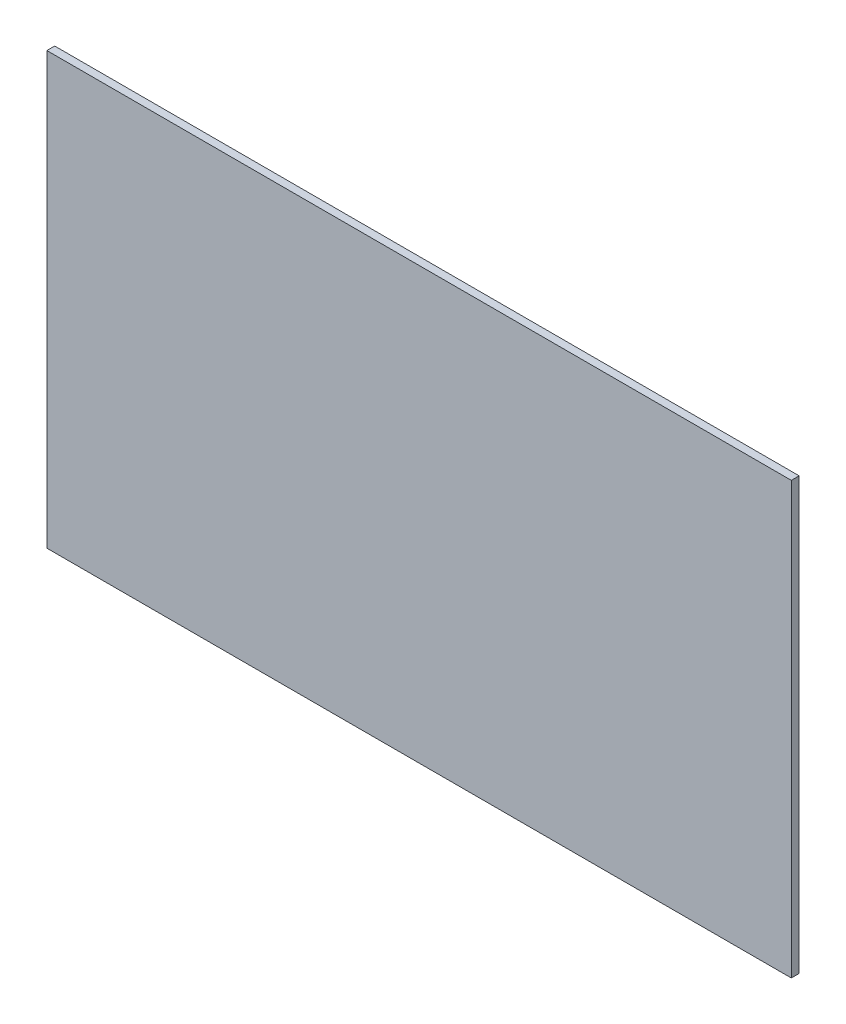
from build123d import *

# Parameters (mm, degrees)
ESQUISSE1_W        = 380
ESQUISSE1_H        = 220
BOSS_EXTRU_1_DEPTH = 4


with BuildPart() as part:
    # Esquisse1 → Boss.-Extru.1 (new body)
    with BuildSketch(Plane.XY):
        with Locations((0.342743613, -31.307106599)):
            Rectangle(ESQUISSE1_W, ESQUISSE1_H)
    extrude(amount=BOSS_EXTRU_1_DEPTH)


solid = part.part
